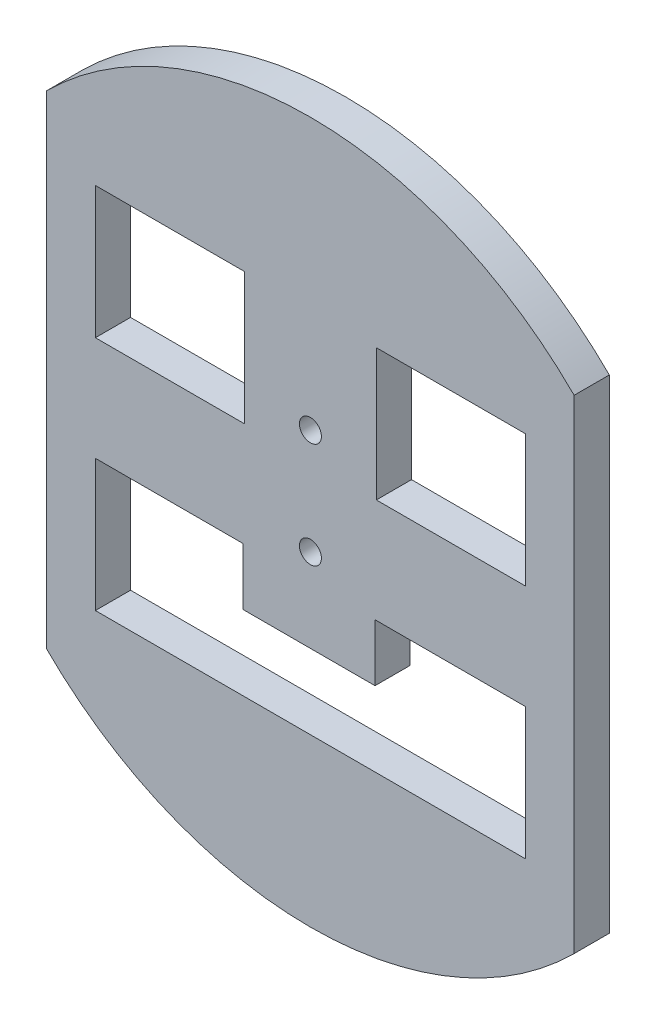
from build123d import *

# Parameters (mm, degrees)
RESSALTO_EXTRUS_O1_DEPTH = 8
CORTE_EXTRUS_O1_DEPTH    = 10
RESSALTO_EXTRUS_O2_REACH = 161.117
ESBO_O3_W                = 30
ESBO_O3_H                = 8
ESBO_O4_R                = 2.5
CORTE_EXTRUS_O2_DEPTH    = 3
ESBO_O5_R                = 2.5
CORTE_EXTRUS_O3_DEPTH    = 5


with BuildPart() as part:
    # Esboço1 → Ressalto-extrusão1 (new body)
    with BuildSketch(Plane.XY):
        with BuildLine():
            Line((0, 0), (0, -110))
            ThreePointArc((0, -110), (60, -134.792027106), (120, -110))
            Line((120, -110), (120, 0))
            ThreePointArc((120, 0), (60, 24.792027106), (0, 0))
        make_face()
    extrude(amount=RESSALTO_EXTRUS_O1_DEPTH)

    # Esboço2 → Corte-extrusão1 (cut)
    with BuildSketch(Plane(origin=(0, 0, 0), x_dir=(-1, 0, 0), z_dir=(0, 0, -1))):
        Polygon((-108.919644627, -96.875), (-11.080355373, -96.875), (-11.080355373, -66.875), (-44.695581191, -66.875), (-44.695581191, -79.875), (-74.695581191, -79.875), (-74.695581191, -66.875), (-108.919644627, -66.875), align=None)
        Polygon((-108.919644627, -43.125), (-75, -43.125), (-75, -30.608967116), (-45, -30.608967116), (-45, -43.125), (-11.080355373, -43.125), (-11.080355373, -13.125), (-108.919644627, -13.125), align=None)
    extrude(amount=-CORTE_EXTRUS_O1_DEPTH, mode=Mode.SUBTRACT)

    # Esboço3 → Ressalto-extrusão2 (add, up to next)
    with BuildSketch(Plane(origin=(0, -30.608967116, 0), x_dir=(1, 0, 0), z_dir=(0, 1, 0)), mode=Mode.PRIVATE) as ressalto_extrus_o2_sk1:
        with Locations((60, -4)):
            Rectangle(ESBO_O3_W, ESBO_O3_H)
    ressalto_extrus_o2_tool1 = extrude(ressalto_extrus_o2_sk1.sketch, amount=RESSALTO_EXTRUS_O2_REACH, mode=Mode.PRIVATE) - part.part
    add(ressalto_extrus_o2_tool1.solids().sort_by_distance((60, -30.608967, 4))[0])

    # Esboço4 → Corte-extrusão2 (cut)
    with BuildSketch(Plane(origin=(0, 0, 0), x_dir=(-1, 0, 0), z_dir=(0, 0, -1))):
        with Locations((-15.09375, 0)):
            Circle(ESBO_O4_R)
        with Locations((-6.09375, -33.44)):
            Circle(ESBO_O4_R)
        with Locations((-6.09375, -75.315)):
            Circle(ESBO_O4_R)
        with Locations((-18.70841508, -112.188026974)):
            Circle(ESBO_O4_R)
        with Locations((-60, -124.187562439)):
            Circle(ESBO_O4_R)
        with Locations((-101.29158492, -112.188026974)):
            Circle(ESBO_O4_R)
        with Locations((-113.90625, -75.315)):
            Circle(ESBO_O4_R)
        with Locations((-113.90625, -33.44)):
            Circle(ESBO_O4_R)
        with Locations((-104.90625, 0)):
            Circle(ESBO_O4_R)
    extrude(amount=-CORTE_EXTRUS_O2_DEPTH, mode=Mode.SUBTRACT)

    # Esboço5 → Corte-extrusão3 (cut)
    with BuildSketch(Plane.XY.offset(8)):
        with Locations((60, -60.875)):
            Circle(ESBO_O5_R)
        with Locations((60, -36.875)):
            Circle(ESBO_O5_R)
    extrude(amount=-CORTE_EXTRUS_O3_DEPTH, mode=Mode.SUBTRACT)


solid = part.part
